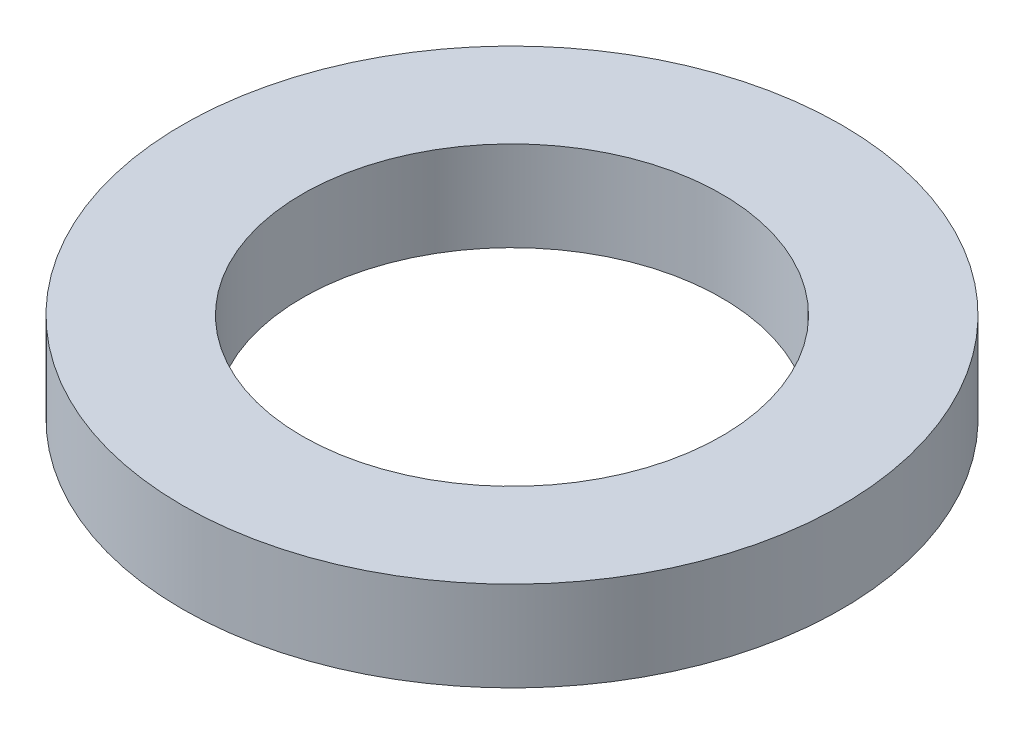
from build123d import *

# Parameters (mm, degrees)
SKETCH1_R           = 55
BOSS_EXTRUDE1_DEPTH = 15
SKETCH2_R           = 35
CUT_EXTRUDE1_DEPTH  = 80.214897589


with BuildPart() as part:
    # Sketch1 → Boss-Extrude1 (new body)
    with BuildSketch(Plane(origin=(0, 0, 0), x_dir=(1, 0, 0), z_dir=(0, 1, 0))):
        Circle(SKETCH1_R)
    extrude(amount=BOSS_EXTRUDE1_DEPTH)

    # Sketch2 → Cut-Extrude1 (cut, through all)
    with BuildSketch(Plane(origin=(0, 0, 0), x_dir=(1, 0, 0), z_dir=(0, 1, 0))):
        Circle(SKETCH2_R)
    extrude(amount=CUT_EXTRUDE1_DEPTH, mode=Mode.SUBTRACT)


solid = part.part
